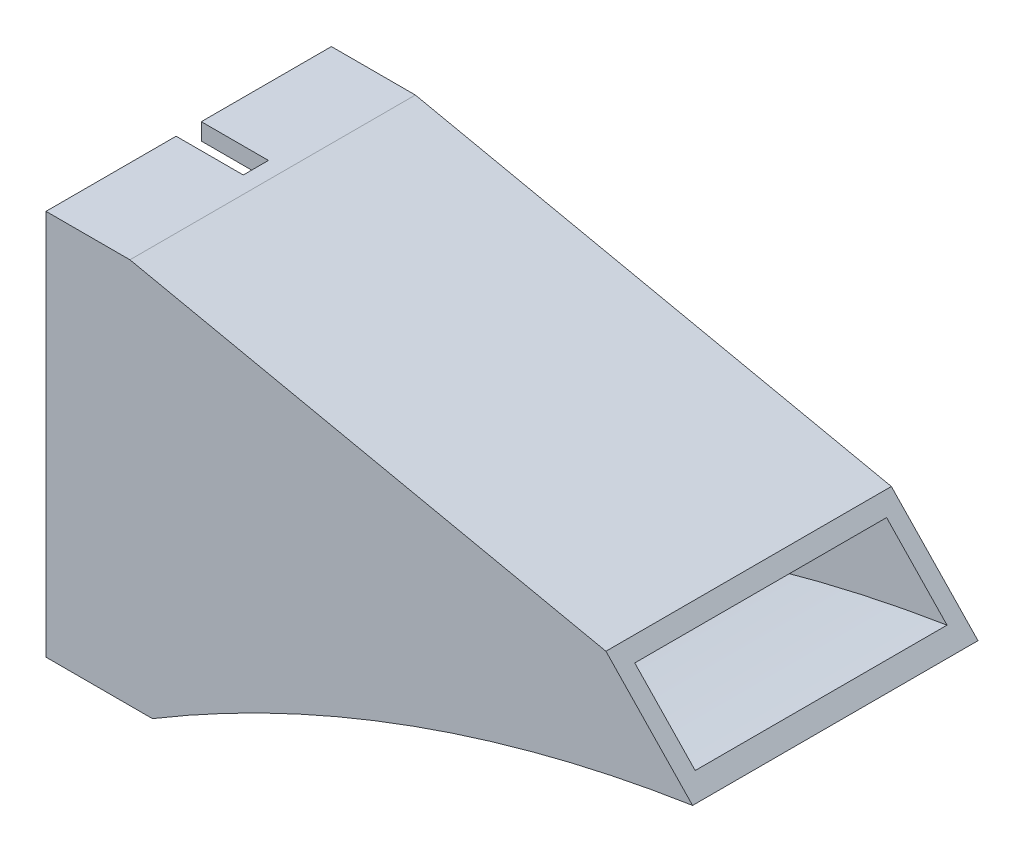
from build123d import *

# Parameters (mm, degrees)
BOSS_EXTRUDE3_START = 1
BOSS_EXTRUDE3_DEPTH = 17
CUT_EXTRUDE1_START  = -1
CUT_EXTRUDE1_DEPTH  = 15
SKETCH3_W           = 1.5
SKETCH3_H           = 3.105761706
CUT_EXTRUDE2_DEPTH  = 4


with BuildPart() as part:
    # Sketch1 → Boss-Extrude3 (new body)
    with BuildSketch(Plane.XY.offset(BOSS_EXTRUDE3_START)):
        with BuildLine():
            Line((22.4, 5.7), (22.4, 28.7))
            Line((22.4, 28.7), (27.4, 28.7))
            Line((27.4, 28.7), (55.753018587, 22.683636365))
            Line((55.753018587, 22.683636365), (60.914628912, 17.309586353))
            ThreePointArc((60.914628912, 17.309586353), (44.261162639, 13.072852444), (28.739278089, 5.7))
            Line((28.739278089, 5.7), (22.4, 5.7))
        make_face()
    extrude(amount=-BOSS_EXTRUDE3_DEPTH)

    # Sketch2 → Cut-Extrude1 (cut)
    with BuildSketch(Plane.XY.offset(1).offset(CUT_EXTRUDE1_START)):
        with BuildLine():
            Line((22.4, 6.7), (28.46302932, 6.7))
            ThreePointArc((28.46302932, 6.7), (43.722391124, 13.941290059), (60.06988402, 18.189098949))
            Line((60.06988402, 18.189098949), (56.469277883, 21.937897528))
            Line((56.469277883, 21.937897528), (54.449845351, 21.937897528))
            Line((54.449845351, 21.937897528), (27.295070739, 27.7))
            Line((27.295070739, 27.7), (22.4, 27.7))
            Line((22.4, 27.7), (22.4, 6.7))
        make_face()
    extrude(amount=-CUT_EXTRUDE1_DEPTH, mode=Mode.SUBTRACT)

    # Sketch3 → Cut-Extrude2 (cut)
    with BuildSketch(Plane.ZY.offset(-22.4)):
        with Locations((-7.5, 28.7)):
            Rectangle(SKETCH3_W, SKETCH3_H)
    extrude(amount=-CUT_EXTRUDE2_DEPTH, mode=Mode.SUBTRACT)


solid = part.part
